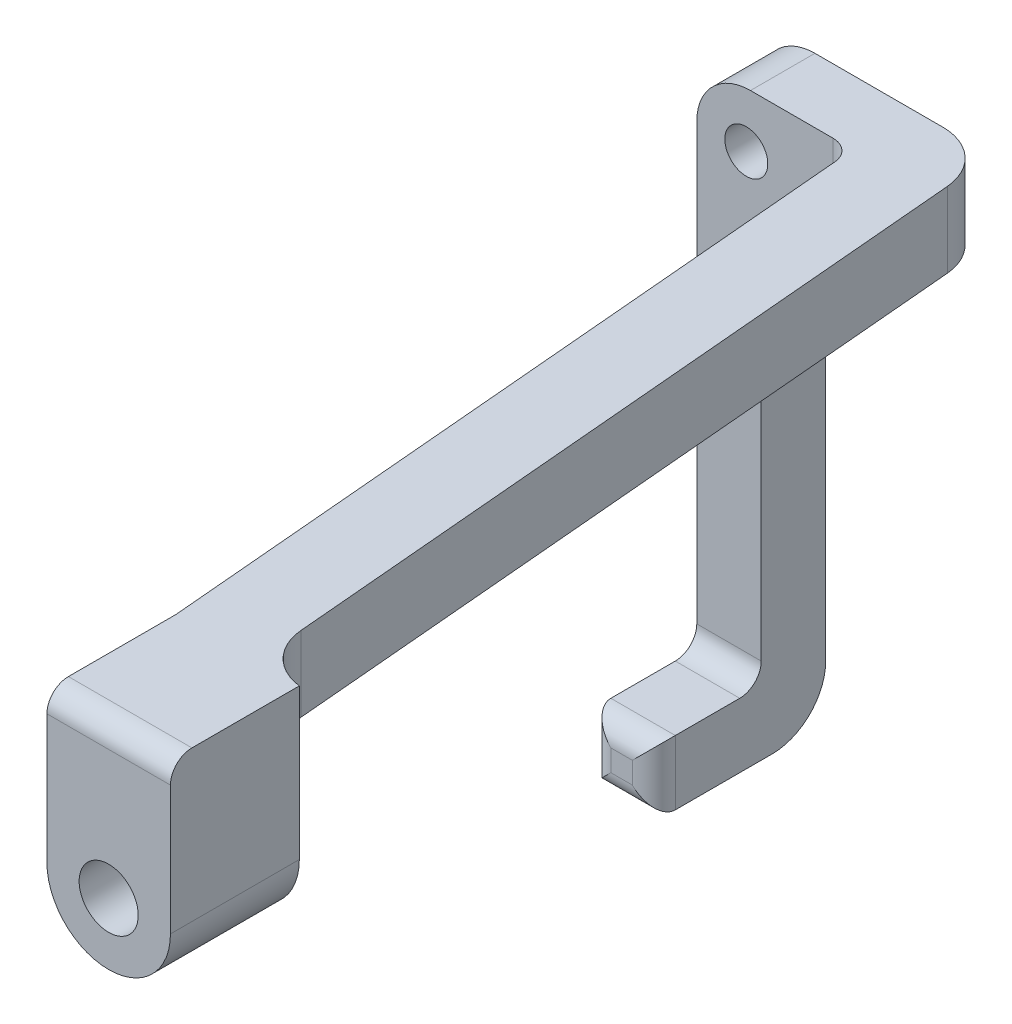
from build123d import *

# Parameters (mm, degrees)
SKETCH1_R           = 1.375
BOSS_EXTRUDE1_DEPTH = 6
BOSS_EXTRUDE2_START = -13.125
SKETCH9_W           = 3.5
SKETCH9_H           = 3
BOSS_EXTRUDE2_DEPTH = 7.26
BOSS_EXTRUDE3_START = -3.5
SKETCH10_W          = 3
SKETCH10_H          = 3
BOSS_EXTRUDE3_DEPTH = 23.25
SKETCH11_W          = 3
SKETCH11_H          = 3
BOSS_EXTRUDE4_DEPTH = 5
FILLET1_R           = 2.5
FILLET2_R           = 1
FILLET3_R           = 3
CUT_EXTRUDE1_REACH  = 51.544
SKETCH12_R          = 1


with BuildPart() as part:
    # Sketch1 → Boss-Extrude1 (new body)
    with BuildSketch(Plane(origin=(0, 0, 0), x_dir=(0, 1, 0), z_dir=(0, 0, 1))):
        with BuildLine():
            Line((0, 2.875), (7, 2.875))
            Line((7, 2.875), (7, -2.875))
            Line((7, -2.875), (0, -2.875))
            ThreePointArc((0, -2.875), (-2.875, 0), (0, 2.875))
        make_face()
        with Locations(Location((0, 0, 0), (0, 0, 270))):
            Circle(SKETCH1_R, mode=Mode.SUBTRACT)
    extrude(amount=BOSS_EXTRUDE1_DEPTH)

    # Sketch2 → Loft1 section 0
    with BuildSketch(Plane(origin=(0, 0, 0), x_dir=(1, 0, 0), z_dir=(0, 0, -1))):
        with BuildLine():
            Line((0.875, -7), (-2.875, -7))
            Line((-2.875, -7), (-2.875, -3.5))
            Line((-2.875, -3.5), (0.875, -3.5))
            Line((0.875, -3.5), (0.875, -7))
        make_face()
    # Sketch8 → Loft1 section 1
    with BuildSketch(Plane(origin=(0, 0, -37.5), x_dir=(-1, 0, 0), z_dir=(0, 0, -1))):
        with BuildLine():
            Line((2.375, 3.5), (2.375, 7))
            Line((2.375, 7), (6.125, 7))
            Line((6.125, 7), (6.125, 3.5))
            Line((6.125, 3.5), (2.375, 3.5))
        make_face()
    loft()

    # Sketch9 → Boss-Extrude2 (add)
    with BuildSketch(Plane.YZ.offset(BOSS_EXTRUDE2_START)):
        with Locations((5.25, -36)):
            Rectangle(SKETCH9_W, SKETCH9_H)
    extrude(amount=BOSS_EXTRUDE2_DEPTH)

    # Sketch10 → Boss-Extrude3 (add)
    with BuildSketch(Plane(origin=(0, 7, 0), x_dir=(-1, 0, 0), z_dir=(0, 1, 0)).offset(BOSS_EXTRUDE3_START)):
        with Locations((11.625, -36)):
            Rectangle(SKETCH10_W, SKETCH10_H)
    extrude(amount=-BOSS_EXTRUDE3_DEPTH)

    # Sketch11 → Boss-Extrude4 (add)
    with BuildSketch(Plane.XY.offset(-34.5)):
        with Locations((-11.625, -18.25)):
            Rectangle(SKETCH11_W, SKETCH11_H)
    extrude(amount=BOSS_EXTRUDE4_DEPTH)

    # Fillet1
    # the kernel refuses this fillet: 2.5 mm, written as the material it adds along each edge
    with BuildSketch(Plane(origin=(0.875, 3.5, 0), x_dir=(-0.08634300732914678, 0, -0.9962654691824658), z_dir=(0, 1, 0))) as fillet1_piece_1:
        with BuildLine():
            CenterArc((2.275267243, -2.5), FILLET1_R, 90, 78.288278187)
            Line((-0.172686015, -1.992530938), (0, 0))
            Line((0, 0), (2.275267243, 0))
        make_face()
    extrude(amount=3.5)
    # the kernel refuses this fillet: 2.5 mm, written as the material it takes off along each edge
    with BuildSketch(Plane(origin=(-19.375, -19.75, -37.5), x_dir=(0, 0, 1), z_dir=(1, 0, 0))) as fillet1_2_piece_1:
        with BuildLine():
            CenterArc((FILLET1_R, -FILLET1_R), FILLET1_R, 90, 90)
            Line((0, -FILLET1_R), (0, 0))
            Line((0, 0), (FILLET1_R, 0))
        make_face()
    extrude(amount=15.5, mode=Mode.SUBTRACT)
    with BuildSketch(Plane(origin=(-2.375, -2.231761645, -37.5), x_dir=(-1, 0, 0), z_dir=(0, 1, 0))) as fillet1_2_piece_2:
        with BuildLine():
            CenterArc((FILLET1_R * 0.917081863151, FILLET1_R), FILLET1_R, 184.953257478, 85.046742522)
            Line((-FILLET1_R * 0.0791836060315, FILLET1_R * 0.913656992671), (0, 0))
            Line((0, 0), (FILLET1_R * 0.917081863151, 0))
        make_face()
    extrude(amount=14.963523289, mode=Mode.SUBTRACT)
    with BuildSketch(Plane(origin=(-13.125, 7, -43.75), x_dir=(0, -1, 0), z_dir=(0, 0, 1))) as fillet1_2_piece_3:
        with BuildLine():
            CenterArc((FILLET1_R, FILLET1_R), FILLET1_R, 180, 90)
            Line((0, FILLET1_R), (0, 0))
            Line((0, 0), (FILLET1_R, 0))
        make_face()
    extrude(amount=15.5, mode=Mode.SUBTRACT)

    # Fillet2
    fillet2_edges = [part.edges().sort_by_distance(p)[0] for p in [
        (0, 7, 6),
        (-5.865, 5.25, -34.5),
        (-11.625, -16.75, -34.5),
        (-11.625, -16.75, -29.5),
        (-13.125, -18.25, -29.5),
        (-11.625, -19.75, -29.5),
        (-10.125, -18.25, -29.5),
    ]]
    fillet(fillet2_edges, radius=FILLET2_R)

    # Fillet3
    fillet3_edges = [part.edges().sort_by_distance(p)[0] for p in [
        (-10.125, 3.5, -36),
    ]]
    fillet(fillet3_edges, radius=FILLET3_R)

    # Sketch12 → Cut-Extrude1 (cut, up to next)
    with BuildSketch(Plane(origin=(0, 0, -37.5), x_dir=(1, 0, 0), z_dir=(0, 0, -1)), mode=Mode.PRIVATE) as cut_extrude1_sk1:
        with Locations(Location((-10.819543648, -4.444543648, 0), (0, 0, 180))):
            Circle(SKETCH12_R)
    cut_extrude1_tool1 = extrude(cut_extrude1_sk1.sketch, amount=-CUT_EXTRUDE1_REACH, mode=Mode.PRIVATE) & part.part
    add(cut_extrude1_tool1.solids().sort_by_distance((-10.819544, 4.444544, -37.5))[0], mode=Mode.SUBTRACT)


solid = part.part
